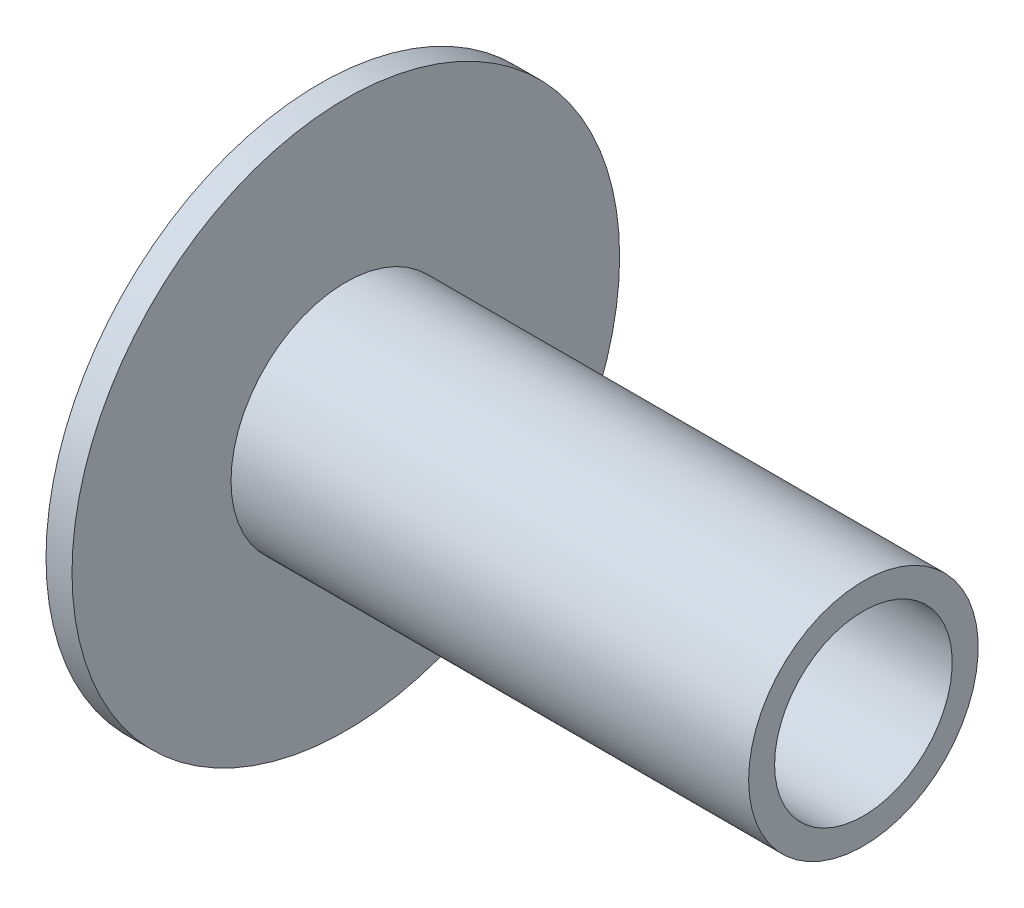
from build123d import *

# Parameters (mm, degrees)
SKETCH2_W = 1.2
SKETCH2_H = 7.341985405


# Read off the part's stored shape, not the designer's step: Revolve-Thin1
with BuildPart() as part:
    # Revolve-Thin1 outline → Revolve-Thin1 (revolve)
    with BuildSketch(Plane.YX):
        Polygon((4.1, 5.4), (3.5, 4.8), (3.5, 1.8), (3.1, 1.8), (2.5, 1.2), (2.5, 0), (3.7, 0), (3.7, 0.6), (4.7, 0.6), (4.7, 4.302943725), (5.3, 4.902943725), (5.3, 30), (4.1, 30), align=None)
    revolve(axis=Axis((0, 0, 0), (1, 0, 0)))

    # Sketch2 → Revolve-Thin2 (revolve)
    with BuildSketch(Plane.XY, mode=Mode.PRIVATE) as revolve_thin2_sk:
        with Locations((5.502943725, 8.970992703)):
            Rectangle(SKETCH2_W, SKETCH2_H)
    revolve(revolve_thin2_sk.sketch.rotate(Axis((0, 0, 0), (1, 0, 0)), 90), axis=Axis((0, 0, 0), (1, 0, 0)))


solid = part.part
